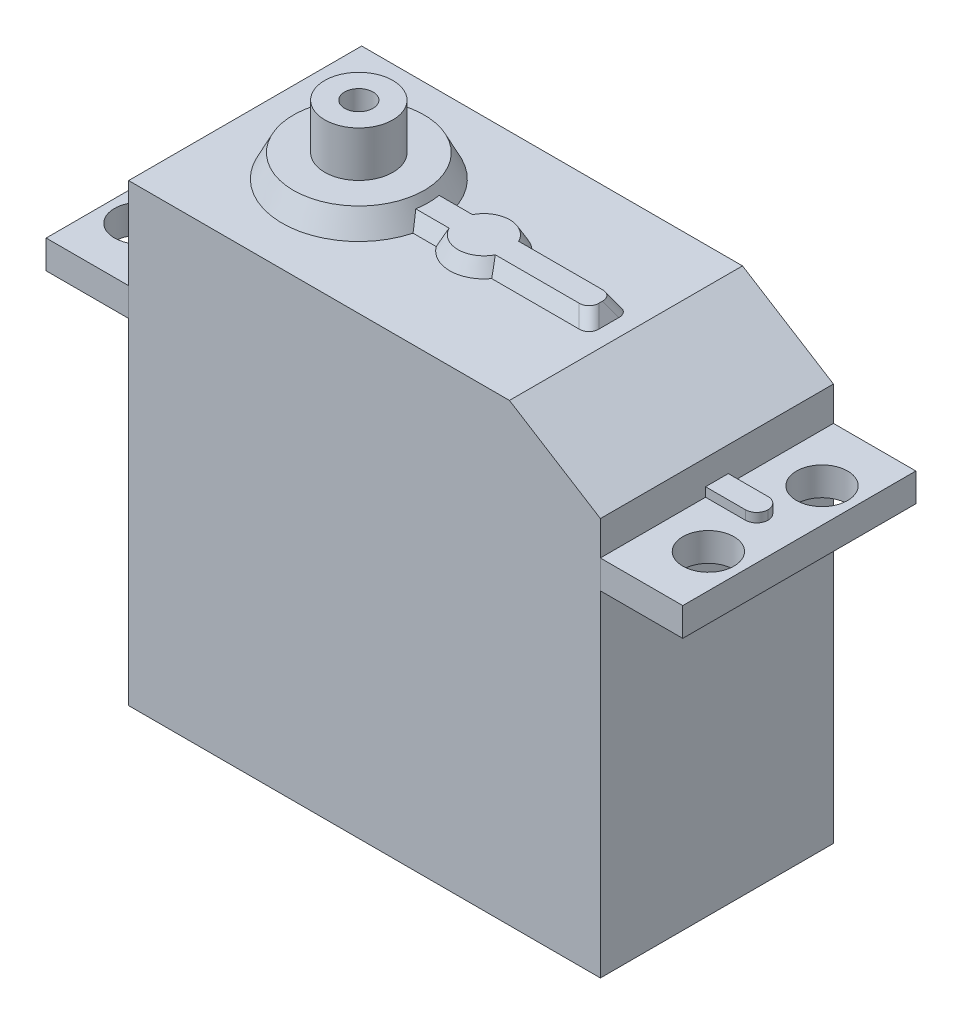
from build123d import *

# Parameters (mm, degrees)
SKETCH1_W           = 41.5
SKETCH1_H           = 20.5
SKETCH1_R           = 1.25
BOSS_EXTRUDE1_DEPTH = 40
CHAMFER1_SIZE       = 5
CHAMFER1_SIZE2      = 8
SKETCH2_W           = 7.25
SKETCH2_H           = 20.506105109
SKETCH2_R           = 2.25
BOSS_EXTRUDE2_DEPTH = 2.5
SKETCH3_W           = 50.5
SKETCH3_H           = 2
BOSS_EXTRUDE3_DEPTH = 0.8
FILLET1_R           = 1
SKETCH4_R           = 6.75
BOSS_EXTRUDE4_DEPTH = 2
CHAMFER2_SIZE2      = 1
CHAMFER2_SIZE       = 2
BOSS_EXTRUDE5_DEPTH = 1.25
BOSS_EXTRUDE5_DRAFT = 30
FILLET2_R           = 1
BOSS_EXTRUDE6_START = 6
SKETCH6_R           = 3
SKETCH6_R_2         = 1.25
BOSS_EXTRUDE6_DEPTH = 6
SKETCH7_R           = 2
SKETCH7_W           = 7
SKETCH7_H           = 4.5
BOSS_EXTRUDE7_DEPTH = 5


with BuildPart() as part:
    # Sketch1 → Boss-Extrude1 (new body)
    with BuildSketch(Plane(origin=(0, 0, 0), x_dir=(1, 0, 0), z_dir=(0, 1, 0))):
        with Locations((10.75, 0)):
            Rectangle(SKETCH1_W, SKETCH1_H)
        with Locations(Location((0, 0, 0), (0, 0, 270))):
            Circle(SKETCH1_R, mode=Mode.SUBTRACT)
    extrude(amount=-BOSS_EXTRUDE1_DEPTH)

    # Chamfer1
    chamfer1_edges = [part.edges().sort_by_distance(p)[0] for p in [
        (31.5, 0, 0),
    ]]
    chamfer1_side = [part.faces().sort_by_distance(p)[0] for p in [
        (31.5, -20, 0),
    ]]
    chamfer(chamfer1_edges, length=CHAMFER1_SIZE, length2=CHAMFER1_SIZE2, reference=chamfer1_side[0])

    # Sketch2 → Boss-Extrude2 (add)
    # profile 1 of 2: a face of its own
    with BuildSketch(Plane(origin=(0, -8, 0), x_dir=(1, 0, 0), z_dir=(0, 1, 0))):
        with Locations((-13.625, -0.003052554)):
            Rectangle(SKETCH2_W, SKETCH2_H)
        with Locations(Location((-14.25, 4.996947445, 0), (0, 0, 270))):
            Circle(SKETCH2_R, mode=Mode.SUBTRACT)
        with Locations(Location((-14.25, -5.003052555, 0), (0, 0, 90))):
            Circle(SKETCH2_R, mode=Mode.SUBTRACT)
    # profile 2 of 2: a face of its own
    with BuildSketch(Plane(origin=(0, -8, 0), x_dir=(1, 0, 0), z_dir=(0, 1, 0))):
        with Locations((35.125, -0.003052554)):
            Rectangle(SKETCH2_W, SKETCH2_H)
        with Locations(Location((35.75, 4.996947445, 0), (0, 0, 90))):
            Circle(SKETCH2_R, mode=Mode.SUBTRACT)
        with Locations(Location((35.75, -5.003052555, 0), (0, 0, 270))):
            Circle(SKETCH2_R, mode=Mode.SUBTRACT)
    extrude(amount=-BOSS_EXTRUDE2_DEPTH)

    # Sketch3 → Boss-Extrude3 (add)
    with BuildSketch(Plane(origin=(0, -8, 0), x_dir=(1, 0, 0), z_dir=(0, 1, 0))):
        with Locations((10.75, 0)):
            Rectangle(SKETCH3_W, SKETCH3_H)
    extrude(amount=BOSS_EXTRUDE3_DEPTH)

    # Fillet1
    fillet1_edges = [part.edges().sort_by_distance(p)[0] for p in [
        (36, -7.6, 1),
        (36, -7.6, -1),
        (-14.5, -7.6, -1),
        (-14.5, -7.6, 1),
    ]]
    fillet(fillet1_edges, radius=FILLET1_R - 0.0001)  # a hair under: the kernel refuses the full size

    # Sketch4 → Boss-Extrude4 (add)
    with BuildSketch(Plane(origin=(0, 0, 0), x_dir=(1, 0, 0), z_dir=(0, 1, 0))):
        with Locations(Location((0, 0, 0), (0, 0, 270))):
            Circle(SKETCH4_R)
    extrude(amount=BOSS_EXTRUDE4_DEPTH)

    # Chamfer2
    chamfer2_edges = [part.edges().sort_by_distance(p)[0] for p in [
        (0, 2, -6.75),
    ]]
    chamfer2_side = [part.faces().sort_by_distance(p)[0] for p in [
        (0, 1.98, -6.75),
    ]]
    chamfer(chamfer2_edges, length=CHAMFER2_SIZE - 0.0001, length2=CHAMFER2_SIZE2 - 0.0001, reference=chamfer2_side[0])  # a hair under: the kernel refuses the full size


with BuildPart() as boss_extrude5_tool:
    # Sketch5 → Boss-Extrude5 (with draft: the straight prism first)
    with BuildSketch(Plane(origin=(0, 0, 0), x_dir=(1, 0, 0), z_dir=(0, 1, 0))):
        with BuildLine():
            ThreePointArc((13.436698586, 1.75), (11, 3), (8.563301414, 1.75))
            Line((8.563301414, 1.75), (2.982880946, 1.75))
            Line((2.982880946, 1.75), (2.982880946, -1.75))
            Line((2.982880946, -1.75), (8.563301414, -1.75))
            ThreePointArc((8.563301414, -1.75), (11, -3), (13.436698586, -1.75))
            Line((13.436698586, -1.75), (22, -1.75))
            Line((22, -1.75), (22, 1.75))
            Line((22, 1.75), (13.436698586, 1.75))
        make_face()
    extrude(amount=BOSS_EXTRUDE5_DEPTH)
    # Boss-Extrude5: the draft: its side faces are tilted about the plane it starts from
    boss_extrude5_sides = [boss_extrude5_tool.faces().sort_by_distance(p)[0] for p in [
        (11, 0.625, -3),
        (5.77309118, 0.625, -1.75),
        (2.982880946, 0.625, 0),
        (5.77309118, 0.625, 1.75),
        (11, 0.625, 3),
        (17.718349293, 0.625, 1.75),
        (22, 0.625, 0),
        (17.718349293, 0.625, -1.75),
    ]]
    draft(boss_extrude5_sides, Plane(origin=(0, 0, 0), x_dir=(1, 0, 0), z_dir=(0, 1, 0)), BOSS_EXTRUDE5_DRAFT)


with BuildPart() as part_1:
    add(part.part)

    # Boss-Extrude5: add boss_extrude5_tool
    add(boss_extrude5_tool.part)

    # Fillet2
    fillet2_edges = [part_1.edges().sort_by_distance(p)[0] for p in [
        (21.639156082, 0.625, 1.389156082),
        (21.639156082, 0.625, -1.389156082),
    ]]
    fillet(fillet2_edges, radius=FILLET2_R)

    # Sketch6 → Boss-Extrude6 (add)
    with BuildSketch(Plane(origin=(0, 0, 0), x_dir=(1, 0, 0), z_dir=(0, 1, 0)).offset(BOSS_EXTRUDE6_START)):
        with Locations(Location((0, 0, 0), (0, 0, 270))):
            Circle(SKETCH6_R)
        with Locations(Location((0, 0, 0), (0, 0, 270))):
            Circle(SKETCH6_R_2, mode=Mode.SUBTRACT)
    extrude(amount=-BOSS_EXTRUDE6_DEPTH)

    # Sketch7 → Boss-Extrude7 (add)
    with BuildSketch(Plane.ZY.offset(10)):
        with Locations((0, -22)):
            Circle(SKETCH7_R)
        with Locations((0, -33.25)):
            Rectangle(SKETCH7_W, SKETCH7_H)
    extrude(amount=BOSS_EXTRUDE7_DEPTH)


solid = part_1.part
